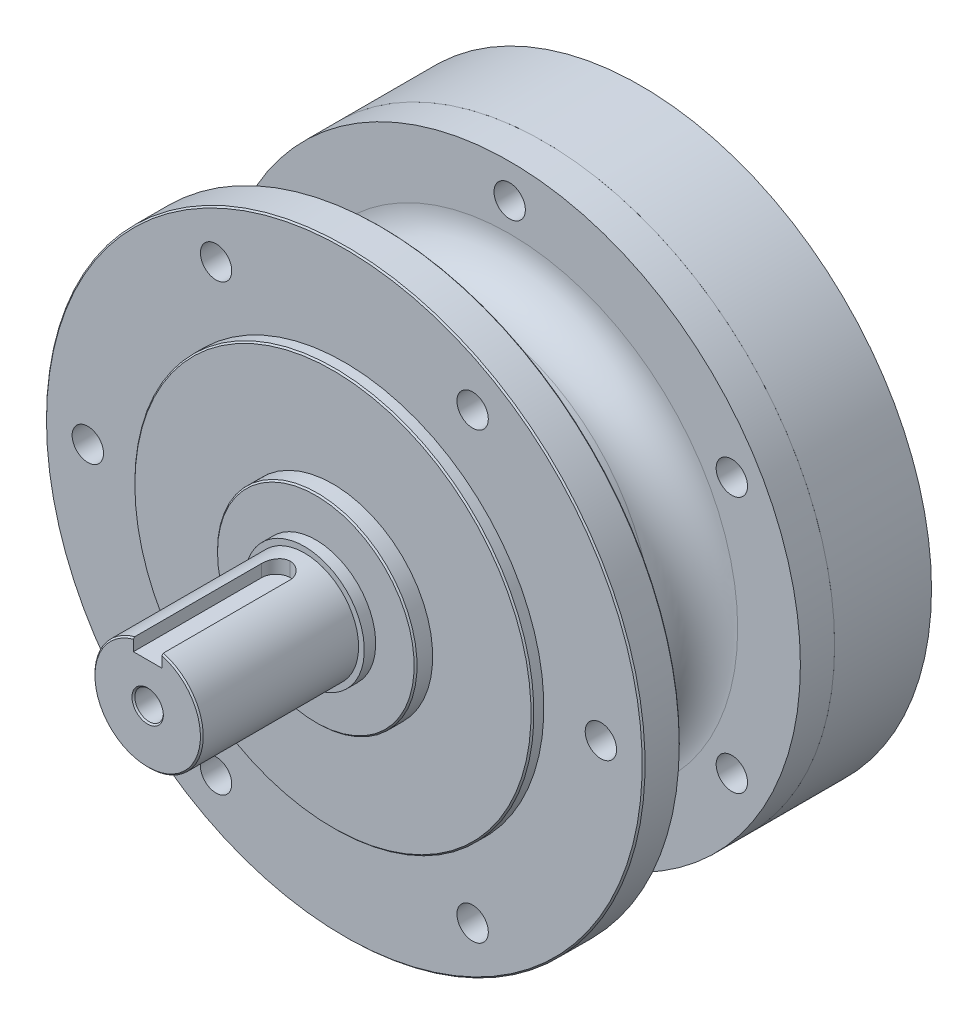
from build123d import *

# Parameters (mm, degrees)
SKETCH_1_R               = 105
EXTRUDE_1_DEPTH          = 13
SKETCH_2_R               = 70
EXTRUDE_2_DEPTH          = 4
SKETCH_3_R               = 35
EXTRUDE_3_DEPTH          = 6
SKETCH_5_R               = 21
EXTRUDE_4_DEPTH          = 4
SKETCH_6_R               = 19
EXTRUDE_5_DEPTH          = 55
SKETCH_7_R               = 65
EXTRUDE_6_DEPTH          = 45
SKETCH_8_R               = 5.5
CUT_EXTRUDE_1_DEPTH      = 75
CHAMFER_1_SIZE           = 0.5
CHAMFER_2_SIZE           = 0.5
SKETCH_9_W               = 10
SKETCH_9_H               = 5
CUT_EXTRUDE_2_DEPTH      = 50
FILLET_1_R               = 5
SKETCH_10_R              = 102
EXTRUDE_7_DEPTH          = 49
FILLET_2_R               = 15
SKETCH_11_R              = 5.5
CUT_EXTRUDE_3_DEPTH      = 55
SKETCH_12_R              = 69
CUT_EXTRUDE_4_DEPTH      = 8
SKETCH_13_R              = 9
CUT_EXTRUDE_5_DEPTH      = 50
CUT_EXTRUDE_6_DEPTH      = 161
CUT_EXTRUDE_6_DEPTH_BACK = 111
SKETCH_14_W              = 0.01
SKETCH_14_H              = 204
SKETCH_15_R              = 5
CUT_EXTRUDE_7_DEPTH      = 30
CHAMFER_3_SIZE           = 0.5
SKETCH_16_R              = 102
SKETCH_16_R_2            = 82
CUT_EXTRUDE_8_DEPTH      = 3


with BuildPart() as part:
    # 草图1 → 拉伸1 (new body)
    with BuildSketch(Plane.XY):
        with Locations(Location((0, 0, 0), (0, 0, 180))):
            Circle(SKETCH_1_R)
    extrude(amount=EXTRUDE_1_DEPTH)

    # 草图2 → 拉伸2 (add)
    with BuildSketch(Plane.XY.offset(13)):
        Circle(SKETCH_2_R)
    extrude(amount=EXTRUDE_2_DEPTH)

    # 草图3 → 拉伸3 (add)
    with BuildSketch(Plane.XY.offset(17)):
        Circle(SKETCH_3_R)
    extrude(amount=EXTRUDE_3_DEPTH)

    # 草图5 → 拉伸4 (add)
    with BuildSketch(Plane.XY.offset(23)):
        Circle(SKETCH_5_R)
    extrude(amount=EXTRUDE_4_DEPTH)

    # 草图6 → 拉伸5 (add)
    with BuildSketch(Plane.XY.offset(27)):
        Circle(SKETCH_6_R)
    extrude(amount=EXTRUDE_5_DEPTH)

    # 草图7 → 拉伸6 (add)
    with BuildSketch(Plane(origin=(0, 0, 0), x_dir=(-1, 0, 0), z_dir=(0, 0, -1))):
        with Locations(Location((0, 0, 0), (0, 0, 180))):
            Circle(SKETCH_7_R)
    extrude(amount=EXTRUDE_6_DEPTH)

    # 草图8 → 切除-拉伸1 (cut)
    with BuildSketch(Plane(origin=(0, 0, 0), x_dir=(-1, 0, 0), z_dir=(0, 0, -1))):
        with Locations((90, 0)):
            Circle(SKETCH_8_R)
        with Locations((45, 77.942286341)):
            Circle(SKETCH_8_R)
        with Locations((45, -77.942286341)):
            Circle(SKETCH_8_R)
        with Locations((-45, -77.942286341)):
            Circle(SKETCH_8_R)
        with Locations((-90, 0)):
            Circle(SKETCH_8_R)
        with Locations((-45, 77.942286341)):
            Circle(SKETCH_8_R)
    extrude(amount=-CUT_EXTRUDE_1_DEPTH, mode=Mode.SUBTRACT)

    # 倒角1
    chamfer_1_edges = [part.edges().sort_by_distance(p)[0] for p in [
        (105, 0, 0),
        (105, 0, 13),
    ]]
    chamfer(chamfer_1_edges, length=CHAMFER_1_SIZE)

    # 倒角2
    chamfer_2_edges = [part.edges().sort_by_distance(p)[0] for p in [
        (-35, 0, 23),
        (-19, 0, 82),
        (-70, 0, 17),
    ]]
    chamfer(chamfer_2_edges, length=CHAMFER_2_SIZE)

    # 草图9 → 切除-拉伸2 (cut)
    with BuildSketch(Plane.XY.offset(82)):
        with Locations((0, 16.5)):
            Rectangle(SKETCH_9_W, SKETCH_9_H)
    extrude(amount=-CUT_EXTRUDE_2_DEPTH, mode=Mode.SUBTRACT)

    # 圆角1
    fillet_1_edges = [part.edges().sort_by_distance(p)[0] for p in [
        (-5, 16.16515139, 32),
        (5, 16.16515139, 32),
    ]]
    fillet(fillet_1_edges, radius=FILLET_1_R - 0.0001)  # a hair under: the kernel refuses the full size

    # 草图10 → 拉伸7 (add)
    with BuildSketch(Plane(origin=(0, 0, -45), x_dir=(-1, 0, 0), z_dir=(0, 0, -1))):
        Circle(SKETCH_10_R)
    extrude(amount=EXTRUDE_7_DEPTH)

    # 圆角2
    fillet_2_edges = [part.edges().sort_by_distance(p)[0] for p in [
        (-65, 0, 0),
        (-65, 0, -45),
    ]]
    fillet(fillet_2_edges, radius=FILLET_2_R)

    # 草图11 → 切除-拉伸3 (cut)
    with BuildSketch(Plane(origin=(0, 0, -94), x_dir=(-1, 0, 0), z_dir=(0, 0, -1))):
        with Locations((0, 90)):
            Circle(SKETCH_11_R)
        with Locations((77.942286341, 45)):
            Circle(SKETCH_11_R)
        with Locations((77.942286341, -45)):
            Circle(SKETCH_11_R)
        with Locations((0, -90)):
            Circle(SKETCH_11_R)
        with Locations((-77.942286341, -45)):
            Circle(SKETCH_11_R)
        with Locations((-77.942286341, 45)):
            Circle(SKETCH_11_R)
    extrude(amount=-CUT_EXTRUDE_3_DEPTH, mode=Mode.SUBTRACT)

    # 草图12 → 切除-拉伸4 (cut)
    with BuildSketch(Plane(origin=(0, 0, -94), x_dir=(-1, 0, 0), z_dir=(0, 0, -1))):
        Circle(SKETCH_12_R)
    extrude(amount=-CUT_EXTRUDE_4_DEPTH, mode=Mode.SUBTRACT)

    # 草图13 → 切除-拉伸5 (cut)
    with BuildSketch(Plane(origin=(0, 0, -86), x_dir=(-1, 0, 0), z_dir=(0, 0, -1))):
        Circle(SKETCH_13_R)
    extrude(amount=-CUT_EXTRUDE_5_DEPTH, mode=Mode.SUBTRACT)

    # 草图14 → 切除-拉伸6 (cut, two sides: drawn at the far end of the back side and taken through both)
    with BuildSketch(Plane(origin=(0, 0, 0), x_dir=(0, 0, -1), z_dir=(1, 0, 0)).offset(-CUT_EXTRUDE_6_DEPTH_BACK)):
        with Locations((57.005, 0)):
            Rectangle(SKETCH_14_W, SKETCH_14_H)
    extrude(amount=CUT_EXTRUDE_6_DEPTH + CUT_EXTRUDE_6_DEPTH_BACK, mode=Mode.SUBTRACT)


with BuildPart() as cut_extrude_6_piece_1:
    # of the separate pieces the step leaves, piece 1, a body of its own (cut_extrude_6_pieces)
    add(part.part.solids().sort_by_distance((-102, 0, -45))[0])

    # 草图15 → 切除-拉伸7 (cut)
    with BuildSketch(Plane.XY.offset(82)):
        Circle(SKETCH_15_R)
    extrude(amount=-CUT_EXTRUDE_7_DEPTH, mode=Mode.SUBTRACT)

    # 倒角3
    chamfer_3_edges = [cut_extrude_6_piece_1.edges().sort_by_distance(p)[0] for p in [
        (-5, 0, 82),
    ]]
    chamfer(chamfer_3_edges, length=CHAMFER_3_SIZE)


with BuildPart() as cut_extrude_6_piece_2:
    # of the separate pieces the step leaves, piece 2, a body of its own (cut_extrude_6_pieces)
    add(part.part.solids().sort_by_distance((-102, 0, -57.01))[0])

    # 草图16 → 切除-拉伸8 (cut)
    with BuildSketch(Plane(origin=(0, 0, -94), x_dir=(-1, 0, 0), z_dir=(0, 0, -1))):
        with Locations(Location((0, 0, 0), (0, 0, 90))):
            Circle(SKETCH_16_R)
        Circle(SKETCH_16_R_2, mode=Mode.SUBTRACT)
    extrude(amount=-CUT_EXTRUDE_8_DEPTH, mode=Mode.SUBTRACT)


solid = Compound([cut_extrude_6_piece_1.part, cut_extrude_6_piece_2.part])
